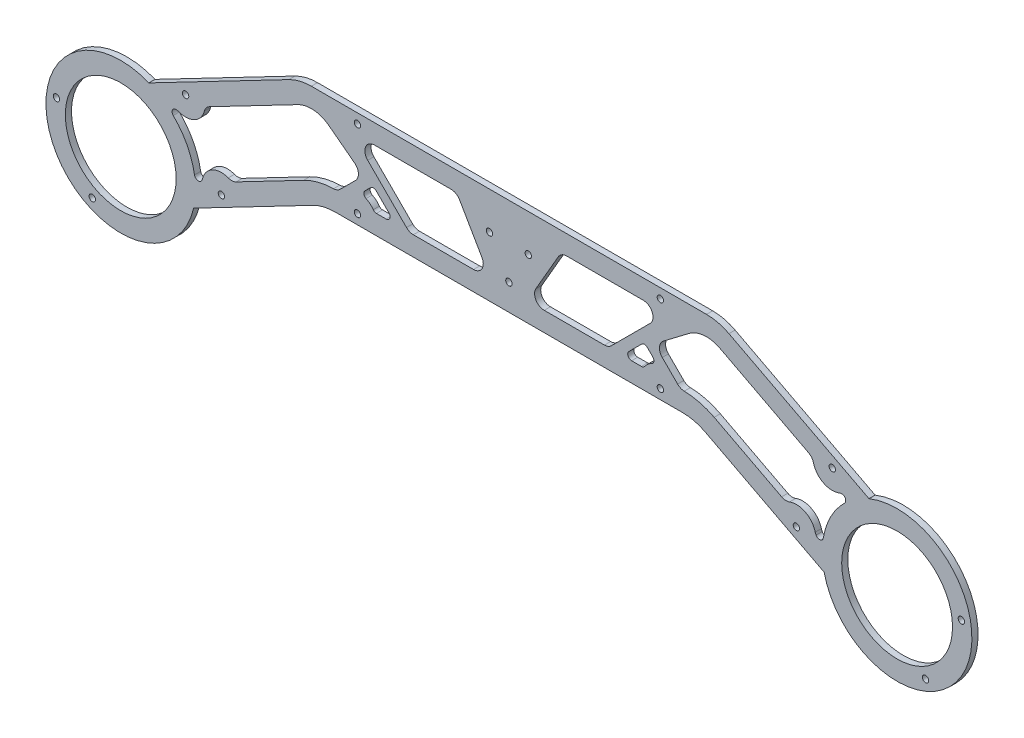
from build123d import *

# Parameters (mm, degrees)
SKETCH1_R              = 16.05
SKETCH1_R_2            = 1.65
BASE_DEPTH             = 3.175
SKETCH3_R              = 1.65
STRUT_HOLES_DEPTH      = 276.893827895
LIGHTENING_HOLES_DEPTH = 276.893827895
INNER_START            = -3.175
SKETCH5_R              = 38.55
SKETCH5_R_2            = 28.55
SKETCH5_R_3            = 1.65
INNER_MOD_BOSS_DEPTH   = 3.175
SKETCH5_2_R            = 28.55
INNER_MOD_CUT_DEPTH    = 278.97307731
FILLET1_R              = 2
FILLET2_R              = 2
FILLET3_R              = 2
FILLET4_R              = 2


with BuildPart() as part:
    # Sketch1 → Base (new body)
    with BuildSketch(Plane.XY):
        with BuildLine():
            Line((-113.35576806, -30.824729171), (-235.437134887, -94.376266227))
            ThreePointArc((-235.437134887, -94.376266227), (-237.896976574, -97.307791395), (-237.563445987, -101.120063459))
            Line((-237.563445987, -101.120063459), (-219.093501457, -136.600496786))
            ThreePointArc((-219.093501457, -136.600496786), (-216.161976289, -139.060338474), (-212.349704225, -138.726807886))
            Line((-212.349704225, -138.726807886), (-101.120845899, -80.824729171))
            ThreePointArc((-101.120845899, -80.824729171), (-95.519277876, -78.716448255), (-89.577130568, -78))
            Line((-89.577130568, -78), (89.577130568, -78))
            ThreePointArc((89.577130568, -78), (95.519277876, -78.716448255), (101.120845899, -80.824729171))
            Line((101.120845899, -80.824729171), (212.349704225, -138.726807886))
            ThreePointArc((212.349704225, -138.726807886), (216.161976289, -139.060338474), (219.093501457, -136.600496786))
            Line((219.093501457, -136.600496786), (237.563445987, -101.120063459))
            ThreePointArc((237.563445987, -101.120063459), (237.896976574, -97.307791395), (235.437134887, -94.376266227))
            Line((235.437134887, -94.376266227), (113.35576806, -30.824729171))
            ThreePointArc((113.35576806, -30.824729171), (107.754200038, -28.716448255), (101.812052729, -28))
            Line((101.812052729, -28), (-101.812052729, -28))
            ThreePointArc((-101.812052729, -28), (-107.754200038, -28.716448255), (-113.35576806, -30.824729171))
        make_face()
        with Locations((-200, -104.11341011)):
            Circle(SKETCH1_R, mode=Mode.SUBTRACT)
        with Locations((-221.458631392, -97.347529622)):
            Circle(SKETCH1_R_2, mode=Mode.SUBTRACT)
        with Locations((-193.234119511, -82.654778719)):
            Circle(SKETCH1_R_2, mode=Mode.SUBTRACT)
        with Locations((-178.541368608, -110.879290599)):
            Circle(SKETCH1_R_2, mode=Mode.SUBTRACT)
        with Locations((-206.765880489, -125.572041502)):
            Circle(SKETCH1_R_2, mode=Mode.SUBTRACT)
        with Locations(Location((206.765880489, -125.572041502, 0), (0, 0, 180))):
            Circle(SKETCH1_R_2, mode=Mode.SUBTRACT)
        with Locations(Location((221.458631392, -97.347529622, 0), (0, 0, 180))):
            Circle(SKETCH1_R_2, mode=Mode.SUBTRACT)
        with Locations(Location((193.234119511, -82.654778719, 0), (0, 0, 180))):
            Circle(SKETCH1_R_2, mode=Mode.SUBTRACT)
        with Locations(Location((178.541368608, -110.879290599, 0), (0, 0, 180))):
            Circle(SKETCH1_R_2, mode=Mode.SUBTRACT)
        with Locations(Location((200, -104.11341011, 0), (0, 0, 180))):
            Circle(SKETCH1_R, mode=Mode.SUBTRACT)
        with Locations((-10, -47.226497308)):
            Circle(SKETCH1_R_2, mode=Mode.SUBTRACT)
        with Locations((10, -47.226497308)):
            Circle(SKETCH1_R_2, mode=Mode.SUBTRACT)
        with Locations((0, -64.547005384)):
            Circle(SKETCH1_R_2, mode=Mode.SUBTRACT)
    extrude(amount=BASE_DEPTH)

    # Sketch3 → Strut Holes (cut, through all)
    with BuildSketch(Plane.XY.offset(3.175)):
        with Locations((-214.658447291, -134.29175372)):
            Circle(SKETCH3_R)
        with Locations((-148.132634803, -99.660607727)):
            Circle(SKETCH3_R)
        with Locations((-78.03119405, -73)):
            Circle(SKETCH3_R)
        with Locations((-78.03119405, -33)):
            Circle(SKETCH3_R)
        with Locations(Location((-166.602579332, -64.1801744, 0), (0, 0, 180))):
            Circle(SKETCH3_R)
        with Locations(Location((-233.128391821, -98.811320393, 0), (0, 0, 180))):
            Circle(SKETCH3_R)
        with Locations((233.128391821, -98.811320393)):
            Circle(SKETCH3_R)
        with Locations((166.602579332, -64.1801744)):
            Circle(SKETCH3_R)
        with Locations(Location((78.03119405, -33, 0), (0, 0, 180))):
            Circle(SKETCH3_R)
        with Locations(Location((78.03119405, -73, 0), (0, 0, 180))):
            Circle(SKETCH3_R)
        with Locations(Location((148.132634803, -99.660607727, 0), (0, 0, 180))):
            Circle(SKETCH3_R)
        with Locations(Location((214.658447291, -134.29175372, 0), (0, 0, 180))):
            Circle(SKETCH3_R)
    extrude(amount=-STRUT_HOLES_DEPTH, mode=Mode.SUBTRACT)

    # Sketch4 → Lightening Holes (cut, through all)
    with BuildSketch(Plane(origin=(0, 0, 0), x_dir=(-1, 0, 0), z_dir=(0, 0, -1))):
        with BuildLine():
            Line((-166.732564066, -103.70620831), (-160.358460468, -100.38806))
            ThreePointArc((-160.358460468, -100.38806), (-158.749015825, -99.059097441), (-157.82234729, -97.188873132))
            ThreePointArc((-157.82234729, -97.188873132), (-152.750120935, -90.790499395), (-144.599570492, -90.305531214))
            ThreePointArc((-144.599570492, -90.305531214), (-142.53605719, -90.619165384), (-140.52429527, -90.063047123))
            Line((-140.52429527, -90.063047123), (-105.738332031, -71.954620839))
            ThreePointArc((-105.738332031, -71.954620839), (-98.269905543, -69.096671797), (-90.347714306, -68.008483875))
            ThreePointArc((-90.347714306, -68.008483875), (-88.493641512, -67.607748759), (-86.922263791, -66.545229763))
            Line((-86.922263791, -66.545229763), (-79.009491694, -58.632457666))
            ThreePointArc((-79.009491694, -58.632457666), (-77.556385787, -54.760066484), (-79.516892411, -51.11817906))
            Line((-79.516892411, -51.11817906), (-92.727653164, -41.063765898))
            ThreePointArc((-92.727653164, -41.063765898), (-100.534196684, -38.054529652), (-108.738281928, -39.694837502))
            Line((-108.738281928, -39.694837502), (-154.376753667, -63.452722127))
            ThreePointArc((-154.376753667, -63.452722127), (-155.986198311, -64.781684686), (-156.912866845, -66.651908996))
            ThreePointArc((-156.912866845, -66.651908996), (-161.9850932, -73.050282732), (-170.135643643, -73.535250914))
            ThreePointArc((-170.135643643, -73.535250914), (-172.199156946, -73.221616743), (-174.210918865, -73.777735004))
            Line((-174.210918865, -73.777735004), (-180.585022463, -77.095883315))
            ThreePointArc((-180.585022463, -77.095883315), (-182.645072259, -79.099137955), (-183.262226102, -81.905551227))
            ThreePointArc((-183.262226102, -81.905551227), (-183.239750678, -82.990325484), (-183.334932996, -84.071149549))
            ThreePointArc((-183.334932996, -84.071149549), (-183.171057415, -86.227404823), (-182.1120053, -88.112796196))
            ThreePointArc((-182.1120053, -88.112796196), (-178.711740004, -93.031443393), (-176.632932149, -98.637997792))
            ThreePointArc((-176.632932149, -98.637997792), (-175.695957289, -100.586938562), (-174.023651545, -101.957954795))
            ThreePointArc((-174.023651545, -101.957954795), (-173.083697968, -102.499921221), (-172.207994291, -103.140532962))
            ThreePointArc((-172.207994291, -103.140532962), (-169.555130221, -104.244682653), (-166.732564066, -103.70620831))
        make_face()
        with BuildLine():
            Line((-68.284399705, -68), (-63.199367137, -68))
            ThreePointArc((-63.199367137, -68), (-61.351608072, -66.765366865), (-61.785153575, -64.585786438))
            Line((-61.785153575, -64.585786438), (-68.424239552, -57.946700461))
            ThreePointArc((-68.424239552, -57.946700461), (-69.838453114, -57.360914023), (-71.252666676, -57.946700461))
            Line((-71.252666676, -57.946700461), (-74.132142401, -60.826176185))
            ThreePointArc((-74.132142401, -60.826176185), (-74.691303243, -62.565648815), (-73.60347304, -64.033658123))
            ThreePointArc((-73.60347304, -64.033658123), (-71.563592326, -65.373065627), (-69.908865429, -67.166666667))
            ThreePointArc((-69.908865429, -67.166666667), (-69.197270634, -67.779513042), (-68.284399705, -68))
        make_face()
        with BuildLine():
            Line((-25.430550415, -40.5), (-13.883545032, -60.5))
            ThreePointArc((-13.883545032, -60.5), (-13.883545032, -65.5), (-18.21367205, -68))
            Line((-18.21367205, -68), (-49.228804389, -68))
            ThreePointArc((-49.228804389, -68), (-51.14222155, -67.619397663), (-52.764338294, -66.535533906))
            Line((-52.764338294, -66.535533906), (-72.764338294, -46.535533906))
            ThreePointArc((-72.764338294, -46.535533906), (-73.848202051, -41.086582838), (-69.228804389, -38))
            Line((-69.228804389, -38), (-29.760677434, -38))
            ThreePointArc((-29.760677434, -38), (-27.260677434, -38.669872981), (-25.430550415, -40.5))
        make_face()
        with BuildLine():
            Line((52.764338294, -66.535533906), (72.764338294, -46.535533906))
            ThreePointArc((72.764338294, -46.535533906), (73.848202051, -41.086582838), (69.228804389, -38))
            Line((69.228804389, -38), (29.760677434, -38))
            ThreePointArc((29.760677434, -38), (27.260677434, -38.669872981), (25.430550415, -40.5))
            Line((25.430550415, -40.5), (13.883545032, -60.5))
            ThreePointArc((13.883545032, -60.5), (13.883545032, -65.5), (18.21367205, -68))
            Line((18.21367205, -68), (49.228804389, -68))
            ThreePointArc((49.228804389, -68), (51.14222155, -67.619397663), (52.764338294, -66.535533906))
        make_face()
        with BuildLine():
            Line((68.284399705, -68), (63.199367137, -68))
            ThreePointArc((63.199367137, -68), (61.351608072, -66.765366865), (61.785153575, -64.585786438))
            Line((61.785153575, -64.585786438), (68.424239552, -57.946700461))
            ThreePointArc((68.424239552, -57.946700461), (69.838453114, -57.360914023), (71.252666676, -57.946700461))
            Line((71.252666676, -57.946700461), (74.132142401, -60.826176185))
            ThreePointArc((74.132142401, -60.826176185), (74.691303243, -62.565648815), (73.60347304, -64.033658123))
            ThreePointArc((73.60347304, -64.033658123), (71.563592326, -65.373065627), (69.908865429, -67.166666667))
            ThreePointArc((69.908865429, -67.166666667), (69.197270634, -67.779513042), (68.284399705, -68))
        make_face()
        with BuildLine():
            Line((154.376753667, -63.452722127), (108.738281928, -39.694837502))
            ThreePointArc((108.738281928, -39.694837502), (100.534196684, -38.054529652), (92.727653164, -41.063765898))
            Line((92.727653164, -41.063765898), (79.516892411, -51.11817906))
            ThreePointArc((79.516892411, -51.11817906), (77.556385787, -54.760066484), (79.009491694, -58.632457666))
            Line((79.009491694, -58.632457666), (86.922263791, -66.545229763))
            ThreePointArc((86.922263791, -66.545229763), (88.493641512, -67.607748759), (90.347714306, -68.008483875))
            ThreePointArc((90.347714306, -68.008483875), (98.269905543, -69.096671797), (105.738332031, -71.954620839))
            Line((105.738332031, -71.954620839), (140.52429527, -90.063047123))
            ThreePointArc((140.52429527, -90.063047123), (142.53605719, -90.619165384), (144.599570492, -90.305531214))
            ThreePointArc((144.599570492, -90.305531214), (152.750120935, -90.790499395), (157.82234729, -97.188873132))
            ThreePointArc((157.82234729, -97.188873132), (158.749015825, -99.059097441), (160.358460468, -100.38806))
            Line((160.358460468, -100.38806), (166.732564066, -103.70620831))
            ThreePointArc((166.732564066, -103.70620831), (169.555130221, -104.244682653), (172.207994291, -103.140532962))
            ThreePointArc((172.207994291, -103.140532962), (173.083697968, -102.499921221), (174.023651545, -101.957954795))
            ThreePointArc((174.023651545, -101.957954795), (175.695957289, -100.586938562), (176.632932149, -98.637997792))
            ThreePointArc((176.632932149, -98.637997792), (178.711740004, -93.031443393), (182.1120053, -88.112796196))
            ThreePointArc((182.1120053, -88.112796196), (183.171057415, -86.227404823), (183.334932996, -84.071149549))
            ThreePointArc((183.334932996, -84.071149549), (183.239750678, -82.990325484), (183.262226102, -81.905551227))
            ThreePointArc((183.262226102, -81.905551227), (182.645072259, -79.099137955), (180.585022463, -77.095883315))
            Line((180.585022463, -77.095883315), (174.210918865, -73.777735004))
            ThreePointArc((174.210918865, -73.777735004), (172.199156946, -73.221616743), (170.135643643, -73.535250914))
            ThreePointArc((170.135643643, -73.535250914), (161.9850932, -73.050282732), (156.912866845, -66.651908996))
            ThreePointArc((156.912866845, -66.651908996), (155.986198311, -64.781684686), (154.376753667, -63.452722127))
        make_face()
    extrude(amount=-LIGHTENING_HOLES_DEPTH, mode=Mode.SUBTRACT)

    # Sketch5 → Inner Mod Boss (add)
    with BuildSketch(Plane(origin=(0, 0, 0), x_dir=(-1, 0, 0), z_dir=(0, 0, -1)).offset(INNER_START)):
        with Locations((-200, -104.11341011)):
            Circle(SKETCH5_R)
        with Locations((-200, -104.11341011)):
            Circle(SKETCH5_R_2, mode=Mode.SUBTRACT)
        with Locations(Location((-233.128391821, -98.811320393, 0), (0, 0, 180))):
            Circle(SKETCH5_R_3, mode=Mode.SUBTRACT)
        with Locations((-214.658447291, -134.29175372)):
            Circle(SKETCH5_R_3, mode=Mode.SUBTRACT)
    inner_mod_boss = extrude(amount=INNER_MOD_BOSS_DEPTH)

    # Sketch5<2> → Inner Mod Cut (cut, through all)
    with BuildSketch(Plane(origin=(0, 0, 0), x_dir=(-1, 0, 0), z_dir=(0, 0, -1))):
        with Locations((-200, -104.11341011)):
            Circle(SKETCH5_2_R)
    inner_mod_cut = extrude(amount=-INNER_MOD_CUT_DEPTH, mode=Mode.SUBTRACT)

    # Fillet1
    # the kernel refuses this fillet: 2 mm, written as the material it adds along each edge
    with BuildSketch(Plane(origin=(175.426696045, -74.410628545, 0), x_dir=(-0.742029638604563, -0.670367075140465, 0), z_dir=(0, 0, 1))) as fillet1_piece_1:
        with BuildLine():
            CenterArc((3.442331352, -1.998105223), FILLET1_R, 92.494227137, 142.480562551)
            Line((2.294457731, -3.635904402), (2.179670369, -3.79968432))
            ThreePointArc((2.179670369, -3.79968432), (0.290420907, -1.354372209), (-0.187450803, -0.069729452))
            Line((-0.187450803, -0.069729452), (0.008703746, 0.199810522))
            ThreePointArc((0.008703746, 0.199810522), (1.677646948, 0.16347817), (3.346590151, 0.199810522))
            Line((3.346590151, 0.199810522), (3.355293896, 0))
        make_face()
    extrude(amount=3.175)
    # the kernel refuses this fillet: 2 mm, written as the material it takes off along each edge

    # Fillet2
    # the kernel refuses this fillet: 2 mm, written as the material it adds along each edge
    with BuildSketch(Plane(origin=(161.574237648, -101.02095354, 0), x_dir=(0.1235218442476911, 0.9923418533920904, 0), z_dir=(0, 0, 1))) as fillet2_piece_1:
        with BuildLine():
            CenterArc((3.442331352, 1.998105223), FILLET2_R, 125.025210311, 142.480562551)
            Line((2.294457731, 3.635904402), (2.179670369, 3.79968432))
            ThreePointArc((2.179670369, 3.79968432), (0.290420907, 1.354372209), (-0.187450803, 0.069729452))
            Line((-0.187450803, 0.069729452), (0.008703746, -0.199810522))
            ThreePointArc((0.008703746, -0.199810522), (1.677646948, -0.16347817), (3.346590151, -0.199810522))
            Line((3.346590151, -0.199810522), (3.355293896, 0))
        make_face()
    extrude(amount=3.175)
    # the kernel refuses this fillet: 2 mm, written as the material it takes off along each edge

    # Mirror1: Inner Mod Boss, Inner Mod Cut across plane
    add(inner_mod_boss.mirror(Plane(origin=(0, 0, 0), x_dir=(0, 0, 1), z_dir=(1, 0, 0))))
    add(inner_mod_cut.mirror(Plane(origin=(0, 0, 0), x_dir=(0, 0, 1), z_dir=(1, 0, 0))), mode=Mode.SUBTRACT)

    # Fillet3
    # the kernel refuses this fillet: 2 mm, written as the material it adds along each edge
    with BuildSketch(Plane(origin=(-175.426696045, -74.410628545, 0), x_dir=(0.742029638604563, -0.670367075140465, 0), z_dir=(0, 0, 1))) as fillet3_piece_1:
        with BuildLine():
            CenterArc((3.442331352, 1.998105223), FILLET3_R, 125.025210311, 142.480562551)
            Line((2.294457731, 3.635904402), (2.179670369, 3.79968432))
            ThreePointArc((2.179670369, 3.79968432), (0.290420907, 1.354372209), (-0.187450803, 0.069729452))
            Line((-0.187450803, 0.069729452), (0.008703746, -0.199810522))
            ThreePointArc((0.008703746, -0.199810522), (1.677646948, -0.16347817), (3.346590151, -0.199810522))
            Line((3.346590151, -0.199810522), (3.355293896, 0))
        make_face()
    extrude(amount=3.175)
    # the kernel refuses this fillet: 2 mm, written as the material it takes off along each edge

    # Fillet4
    # the kernel refuses this fillet: 2 mm, written as the material it adds along each edge
    with BuildSketch(Plane(origin=(-161.574237648, -101.02095354, 0), x_dir=(-0.12352184424769684, 0.9923418533920898, 0), z_dir=(0, 0, 1))) as fillet4_piece_1:
        with BuildLine():
            CenterArc((3.442331352, -1.998105223), FILLET4_R, 92.494227137, 142.480562551)
            Line((2.294457731, -3.635904402), (2.179670369, -3.79968432))
            ThreePointArc((2.179670369, -3.79968432), (0.290420907, -1.354372209), (-0.187450803, -0.069729452))
            Line((-0.187450803, -0.069729452), (0.008703746, 0.199810522))
            ThreePointArc((0.008703746, 0.199810522), (1.677646948, 0.16347817), (3.346590151, 0.199810522))
            Line((3.346590151, 0.199810522), (3.355293896, 0))
        make_face()
    extrude(amount=3.175)
    # the kernel refuses this fillet: 2 mm, written as the material it takes off along each edge


solid = part.part
